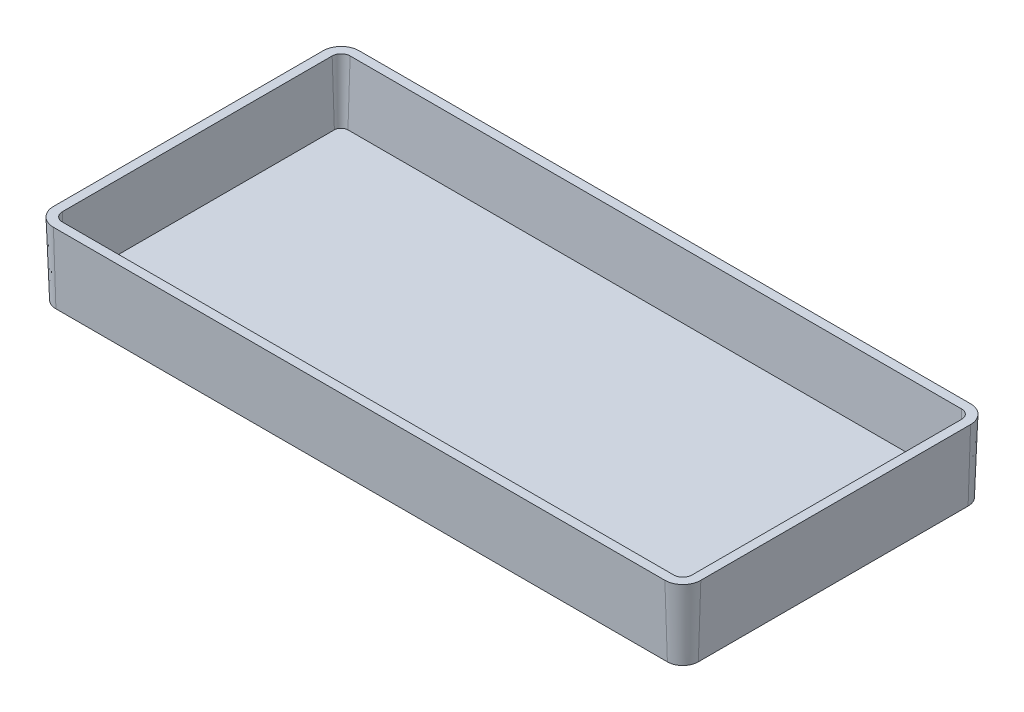
from build123d import *

# Parameters (mm, degrees)
BOSS_EXTRUDE1_DEPTH = 4
BOSS_EXTRUDE1_DRAFT = -2
SHELL1_T            = -0.5


with BuildPart() as part:
    # Sketch1 → Boss-Extrude1 (with draft: the straight prism first)
    with BuildSketch(Plane(origin=(0, 0, 0), x_dir=(1, 0, 0), z_dir=(0, 1, 0))):
        with BuildLine():
            Line((-17, -8.5), (17, -8.5))
            ThreePointArc((17, -8.5), (17.707106781, -8.207106781), (18, -7.5))
            Line((18, -7.5), (18, 7.5))
            ThreePointArc((18, 7.5), (17.707106781, 8.207106781), (17, 8.5))
            Line((17, 8.5), (-17, 8.5))
            ThreePointArc((-17, 8.5), (-17.707106781, 8.207106781), (-18, 7.5))
            Line((-18, 7.5), (-18, -7.5))
            ThreePointArc((-18, -7.5), (-17.707106781, -8.207106781), (-17, -8.5))
        make_face()
    extrude(amount=-BOSS_EXTRUDE1_DEPTH)
    # Boss-Extrude1: the draft: its side faces are tilted about the plane it starts from
    boss_extrude1_sides = [part.faces().sort_by_distance(p)[0] for p in [
        (0, -2, 8.5),
        (17.707106781, -2, 8.207106781),
        (18, -2, 0),
        (17.707106781, -2, -8.207106781),
        (0, -2, -8.5),
        (-17.707106781, -2, -8.207106781),
        (-18, -2, 0),
        (-17.707106781, -2, 8.207106781),
    ]]
    draft(boss_extrude1_sides, Plane(origin=(0, 0, 0), x_dir=(1, 0, 0), z_dir=(0, 1, 0)), BOSS_EXTRUDE1_DRAFT)

    # Shell1
    shell1_openings = [part.faces().sort_by_distance(p)[0] for p in [
        (0, 0, 0),
    ]]
    offset(amount=SHELL1_T, openings=shell1_openings, kind=Kind.INTERSECTION)


solid = part.part
